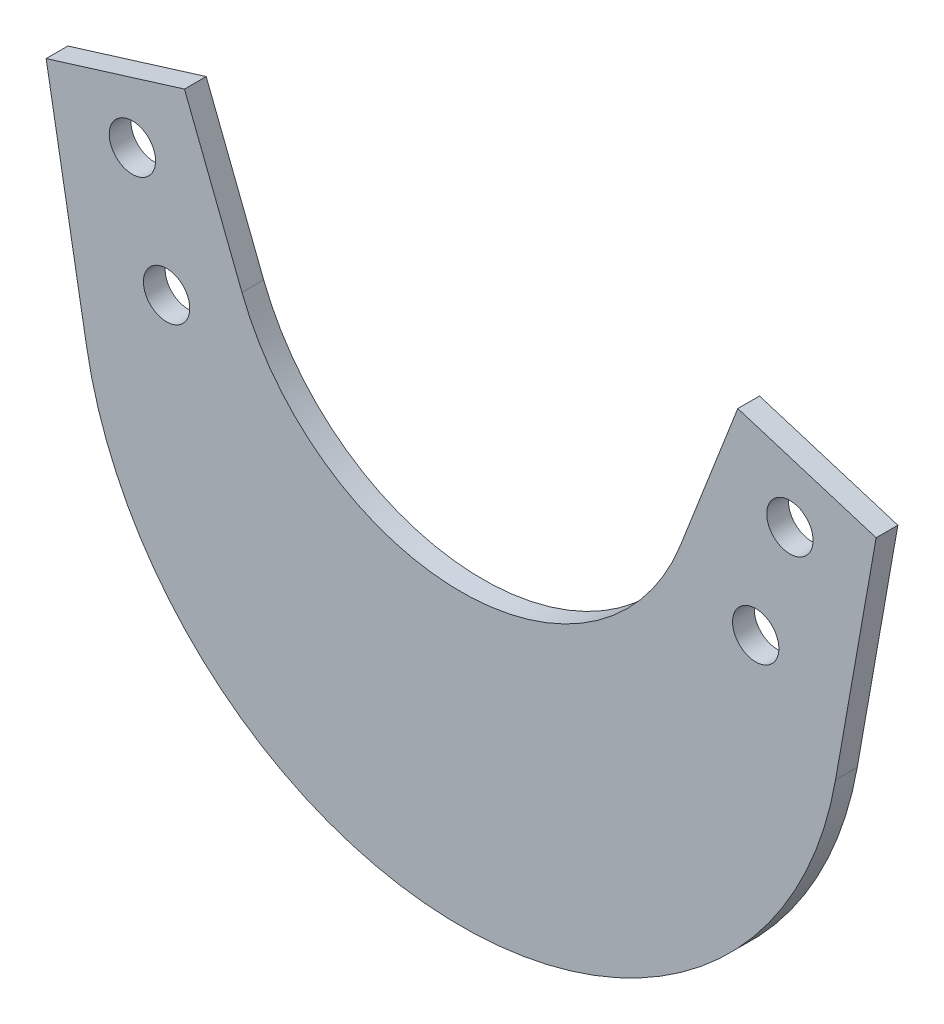
from build123d import *

# Parameters (mm, degrees)
SKETCH1_R           = 1.6
BOSS_EXTRUDE1_DEPTH = 1.5


with BuildPart() as part:
    # Sketch1 → Boss-Extrude1 (new body)
    with BuildSketch(Plane.XY):
        with BuildLine():
            Line((25.85974293, -14.554976912), (28.663386119, 1.32487132))
            Line((28.663386119, 1.32487132), (19.108746057, 4.275947949))
            Line((19.108746057, 4.275947949), (15.138453004, -5.904104582))
            ThreePointArc((15.138453004, -5.904104582), (0, -16.249037211), (-15.138453004, -5.904104582))
            Line((-15.138453004, -5.904104582), (-19.108746057, 4.275947949))
            Line((-19.108746057, 4.275947949), (-28.663386119, 1.32487132))
            Line((-28.663386119, 1.32487132), (-25.85974293, -14.554976912))
            ThreePointArc((-25.85974293, -14.554976912), (0, -36.249037211), (25.85974293, -14.554976912))
        make_face()
        with Locations((-20.344774133, -8.665158441)):
            Circle(SKETCH1_R, mode=Mode.SUBTRACT)
        with Locations((-22.705635436, -1.021446391)):
            Circle(SKETCH1_R, mode=Mode.SUBTRACT)
        with Locations((22.705635436, -1.021446391)):
            Circle(SKETCH1_R, mode=Mode.SUBTRACT)
        with Locations((20.344774133, -8.665158441)):
            Circle(SKETCH1_R, mode=Mode.SUBTRACT)
    extrude(amount=BOSS_EXTRUDE1_DEPTH)


solid = part.part
